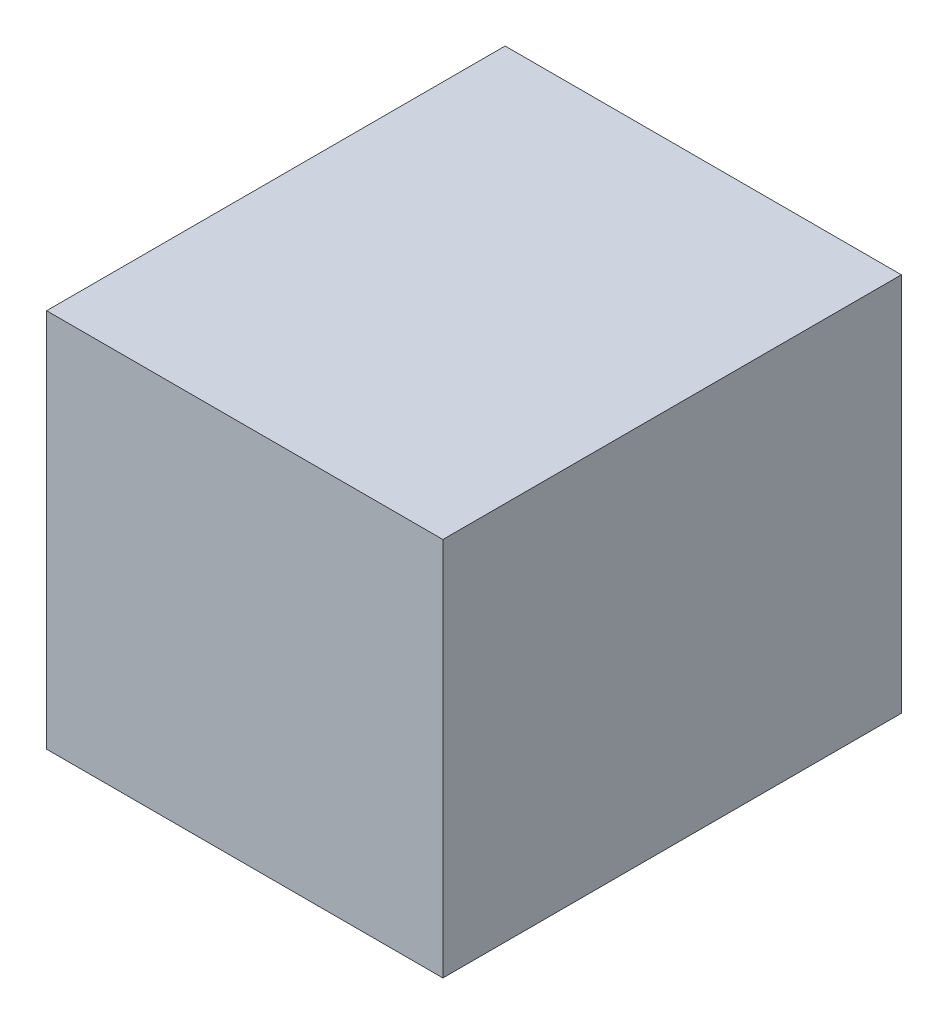
from build123d import *

# Parameters (mm, degrees)
SKETCH1_W           = 31.30472038
SKETCH1_H           = 36.22033763
BOSS_EXTRUDE1_DEPTH = 30


with BuildPart() as part:
    # Sketch1 → Boss-Extrude1 (new body)
    with BuildSketch(Plane(origin=(0, 0, 0), x_dir=(1, 0, 0), z_dir=(0, 1, 0))):
        Rectangle(SKETCH1_W, SKETCH1_H)
    extrude(amount=BOSS_EXTRUDE1_DEPTH)


solid = part.part
